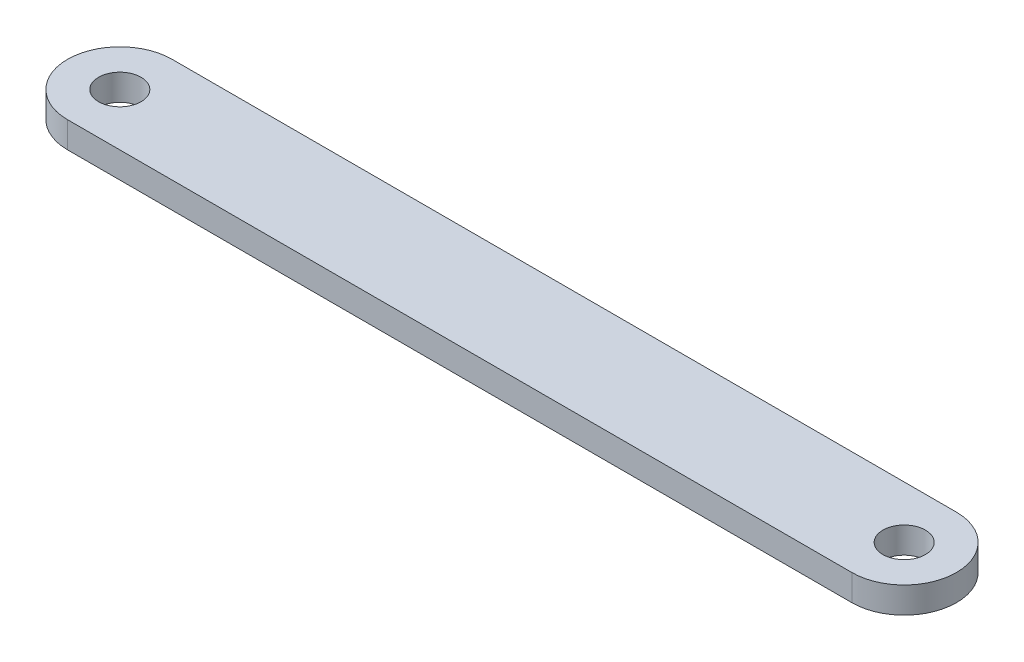
from build123d import *

# Parameters (mm, degrees)
SKETCH1_R           = 2.5796875
BOSS_EXTRUDE1_DEPTH = 3.175


with BuildPart() as part:
    # Sketch1 → Boss-Extrude1 (new body)
    with BuildSketch(Plane(origin=(0, 0, 0), x_dir=(1, 0, 0), z_dir=(0, 1, 0))):
        with BuildLine():
            Line((-47.625, 6.35), (47.625, 6.35))
            ThreePointArc((47.625, 6.35), (53.975, 0), (47.625, -6.35))
            Line((47.625, -6.35), (-47.625, -6.35))
            ThreePointArc((-47.625, -6.35), (-53.975, 0), (-47.625, 6.35))
        make_face()
        with Locations((47.625, 0)):
            Circle(SKETCH1_R, mode=Mode.SUBTRACT)
        with Locations((-47.625, 0)):
            Circle(SKETCH1_R, mode=Mode.SUBTRACT)
    extrude(amount=BOSS_EXTRUDE1_DEPTH)


solid = part.part
